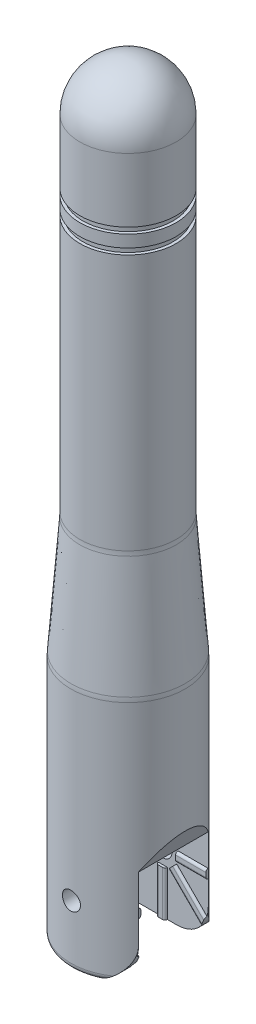
from build123d import *

# Parameters (mm, degrees)
ESQUISSE3_W                  = 7.5
ESQUISSE3_H                  = 5.8
ENL_V_MAT_EXTRU_1_DEPTH      = 8
CONG_1_R                     = 0.5
ENL_V_MAT_EXTRU_2_DEPTH      = 64.516622885
ENL_V_MAT_EXTRU_2_DEPTH_BACK = 64.516622885
ESQUISSE4_R                  = 0.75
ESQUISSE5_W                  = 0.75
ESQUISSE5_H                  = 3.75
ESQUISSE5_W_2                = 2.511980861
ESQUISSE5_H_2                = 0.75
BOSS_EXTRU_1_DEPTH           = 0.2
CONG_2_R                     = 0.2
CONG_2_OF_SYM_TRIE1_R        = 0.2
ENL_V_MAT_EXTRU_3_DEPTH      = 64.799070395


with BuildPart() as part:
    # Esquisse2 → Révolution1 (revolve)
    with BuildSketch(Plane.XY):
        with BuildLine():
            Line((4.014003451, 30.213287326), (4.735996549, 20.586712674))
            ThreePointArc((4.735996549, 20.586712674), (4.746497911, 20.399868856), (4.75, 20.212762933))
            Line((4.75, 20.212762933), (4.75, 0))
            Line((4.75, 0), (1, 0))
            Line((1, 0), (1, 59.160402))
            Line((1, 59.160402), (0, 59.160402))
            Line((0, 59.160402), (0, 63.160402))
            ThreePointArc((0, 63.160402), (2.828427125, 61.988829125), (4, 59.160402))
            Line((4, 59.160402), (4, 53.860402))
            Line((4, 53.860402), (3.75, 53.860402))
            Line((3.75, 53.860402), (3.75, 53.360402))
            Line((3.75, 53.360402), (4, 53.360402))
            Line((4, 53.360402), (4, 52.360402))
            Line((4, 52.360402), (3.75, 52.360402))
            Line((3.75, 52.360402), (3.75, 51.860402))
            Line((3.75, 51.860402), (4, 51.860402))
            Line((4, 51.860402), (4, 30.587237067))
            ThreePointArc((4, 30.587237067), (4.003502089, 30.400131144), (4.014003451, 30.213287326))
        make_face()
    revolve(axis=Axis((0, 0, 0), (0, 1, 0)))

    # Esquisse3 → Enlèv. mat.-Extru.1 (cut)
    with BuildSketch(Plane.XZ):
        with Locations((1, 0)):
            Rectangle(ESQUISSE3_W, ESQUISSE3_H)
    extrude(amount=-ENL_V_MAT_EXTRU_1_DEPTH, mode=Mode.SUBTRACT)

    # Congé1
    cong_1_edges = [part.edges().sort_by_distance(p)[0] for p in [
        (-4.75, 0, 0),
    ]]
    fillet(cong_1_edges, radius=CONG_1_R)

    # Esquisse4 → Enlèv. mat.-Extru.2 (cut, two sides: drawn at the far end of the back side and taken through both)
    with BuildSketch(Plane.XY.offset(-ENL_V_MAT_EXTRU_2_DEPTH_BACK)):
        with Locations((0, 5)):
            Circle(ESQUISSE4_R)
        with BuildLine():
            Line((1.161980861, 0), (3.761980861, 0))
            Line((3.761980861, 0), (3.761980861, 2.6))
            ThreePointArc((3.761980861, 2.6), (3.000458492, 0.761522369), (1.161980861, 0))
        make_face()
        Polygon((3.761980861, 8), (4.75, 10), (4.75, 8), align=None)
    extrude(amount=ENL_V_MAT_EXTRU_2_DEPTH + ENL_V_MAT_EXTRU_2_DEPTH_BACK, mode=Mode.SUBTRACT)

    # Esquisse5 → Boss.-Extru.1 (add)
    with BuildSketch(Plane.XY.offset(-2.9)):
        with Locations((0, 1.875)):
            Rectangle(ESQUISSE5_W, ESQUISSE5_H)
        Polygon((0.618718434, 3.850951481), (1.149048519, 4.381281566), (4.027145904, 1.503184182), (3.496815818, 0.972854096), align=None)
        with Locations((2.50599043, 5)):
            Rectangle(ESQUISSE5_W_2, ESQUISSE5_H_2)
    boss_extru_1 = extrude(amount=BOSS_EXTRU_1_DEPTH)

    # Congé2
    cong_2_edges = [part.edges().sort_by_distance(p)[0] for p in [
        (2.505990431, 5.375, -2.7),
        (2.505990431, 4.625, -2.7),
        (2.588097212, 2.942232874, -2.7),
        (2.057767126, 2.411902788, -2.7),
        (-0.375, 1.875, -2.7),
        (0.375, 1.875, -2.7),
    ]]
    fillet(cong_2_edges, radius=CONG_2_R - 0.0001)  # a hair under: the kernel refuses the full size

    # Symétrie1: Boss.-Extru.1 across plane
    add(boss_extru_1.mirror(Plane.XY))

    # Congé2 of Symétrie1
    cong_2_of_sym_trie1_edges = [part.edges().sort_by_distance(p)[0] for p in [
        (2.505990431, 5.375, 2.7),
        (2.505990431, 4.625, 2.7),
        (2.588097212, 2.942232874, 2.7),
        (2.057767126, 2.411902788, 2.7),
        (-0.375, 1.875, 2.7),
        (0.375, 1.875, 2.7),
    ]]
    fillet(cong_2_of_sym_trie1_edges, radius=CONG_2_OF_SYM_TRIE1_R - 0.0001)  # a hair under: the kernel refuses the full size

    # Esquisse6 → Enlèv. mat.-Extru.3 (cut, through all)
    with BuildSketch(Plane.XY.offset(2.9)):
        with BuildLine():
            Line((4.027145904, 1.503184182), (3.658059706, 1.87227038))
            ThreePointArc((3.658059706, 1.87227038), (3.516870908, 1.49795968), (3.319930166, 1.149739748))
            Line((3.319930166, 1.149739748), (3.496815818, 0.972854096))
            Line((3.496815818, 0.972854096), (4.027145904, 1.503184182))
        make_face()
    extrude(amount=-ENL_V_MAT_EXTRU_3_DEPTH, mode=Mode.SUBTRACT)


solid = part.part
